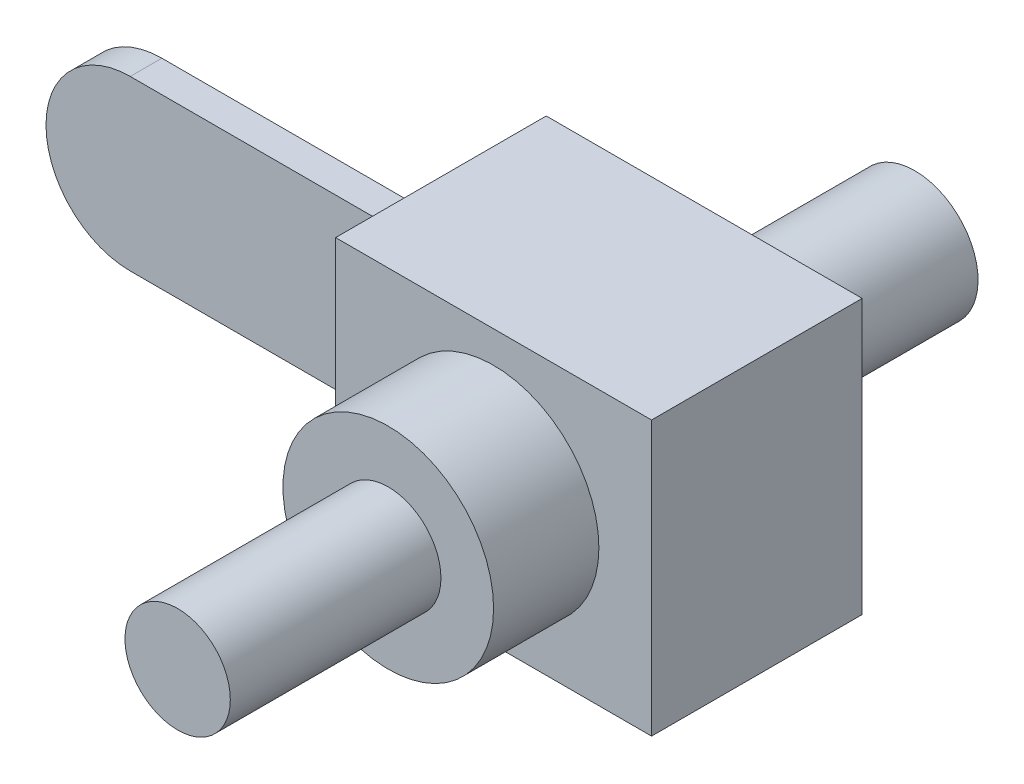
from build123d import *

# Parameters (mm, degrees)
BOSS_EXTRUDE1_DEPTH = 7.5
SKETCH3_W           = 100
SKETCH3_H           = 130
BOSS_EXTRUDE2_DEPTH = 150
SKETCH4_R           = 30
BOSS_EXTRUDE3_DEPTH = 100
SKETCH5_R           = 50
BOSS_EXTRUDE4_DEPTH = 50
SKETCH6_R           = 25
BOSS_EXTRUDE5_DEPTH = 100


with BuildPart() as part:
    # Sketch1 → Boss-Extrude1 (new, symmetric)
    with BuildSketch(Plane.XY):
        with BuildLine():
            Line((0, 40), (140, 40))
            Line((140, 40), (140, -40))
            Line((140, -40), (0, -40))
            ThreePointArc((0, -40), (-40, 0), (0, 40))
        make_face()
    extrude(amount=BOSS_EXTRUDE1_DEPTH, both=True)

    # Sketch3 → Boss-Extrude2 (add)
    with BuildSketch(Plane(origin=(140, 0, 0), x_dir=(0, 0, -1), z_dir=(1, 0, 0))):
        Rectangle(SKETCH3_W, SKETCH3_H)
    extrude(amount=BOSS_EXTRUDE2_DEPTH)

    # Sketch4 → Boss-Extrude3 (add)
    with BuildSketch(Plane(origin=(0, 0, -50), x_dir=(-1, 0, 0), z_dir=(0, 0, -1))):
        with Locations((-215, 0)):
            Circle(SKETCH4_R)
    extrude(amount=BOSS_EXTRUDE3_DEPTH)

    # Sketch5 → Boss-Extrude4 (add)
    with BuildSketch(Plane.XY.offset(50)):
        with Locations((215, 0)):
            Circle(SKETCH5_R)
    extrude(amount=BOSS_EXTRUDE4_DEPTH)

    # Sketch6 → Boss-Extrude5 (add)
    with BuildSketch(Plane.XY.offset(100)):
        with Locations((215, 0)):
            Circle(SKETCH6_R)
    extrude(amount=BOSS_EXTRUDE5_DEPTH)


solid = part.part
